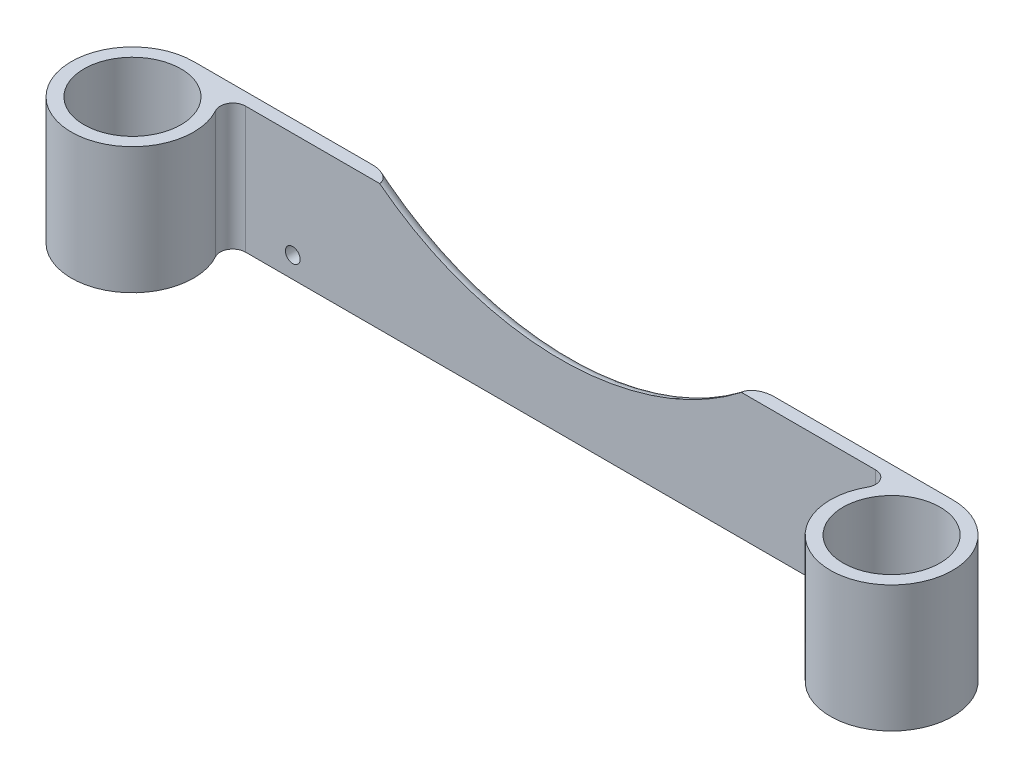
from build123d import *

# Parameters (mm, degrees)
SKETCH1_R           = 11.5
BOSS_EXTRUDE1_DEPTH = 30
FILLET1_R           = 3
SKETCH2_R           = 70
SKETCH2_R_2         = 1.75
CUT_EXTRUDE1_DEPTH  = 30
FILLET2_R           = 3


with BuildPart() as part:
    # Sketch1 → Boss-Extrude1 (new body)
    with BuildSketch(Plane(origin=(0, 0, 0), x_dir=(1, 0, 0), z_dir=(0, 1, 0))):
        with BuildLine():
            Line((0, 14.5), (180, 14.5))
            ThreePointArc((180, 14.5), (184.663689527, -13.729530218), (171.168239134, 11.5))
            Line((171.168239134, 11.5), (8.831760866, 11.5))
            ThreePointArc((8.831760866, 11.5), (-4.663689527, -13.729530218), (0, 14.5))
        make_face()
        with Locations(Location((0, 0, 0), (0, 0, 270))):
            Circle(SKETCH1_R, mode=Mode.SUBTRACT)
        with Locations(Location((180, 0, 0), (0, 0, 270))):
            Circle(SKETCH1_R, mode=Mode.SUBTRACT)
    extrude(amount=BOSS_EXTRUDE1_DEPTH)

    # Fillet1
    fillet1_edges = [part.edges().sort_by_distance(p)[0] for p in [
        (171.168239134, 15, -11.5),
        (8.831760866, 15, -11.5),
    ]]
    fillet(fillet1_edges, radius=FILLET1_R)

    # Sketch2 → Cut-Extrude1 (cut)
    with BuildSketch(Plane(origin=(0, 0, -14.5), x_dir=(-1, 0, 0), z_dir=(0, 0, -1))):
        with Locations((-90, 85.31324406)):
            Circle(SKETCH2_R)
        with Locations((-26.5, 5)):
            Circle(SKETCH2_R_2)
        with Locations((-153.5, 5)):
            Circle(SKETCH2_R_2)
    extrude(amount=-CUT_EXTRUDE1_DEPTH, mode=Mode.SUBTRACT)

    # Fillet2
    fillet2_edges = [part.edges().sort_by_distance(p)[0] for p in [
        (90, 15.31324406, -14.5),
    ]]
    fillet(fillet2_edges, radius=FILLET2_R - 0.0001)  # a hair under: the kernel refuses the full size


solid = part.part
